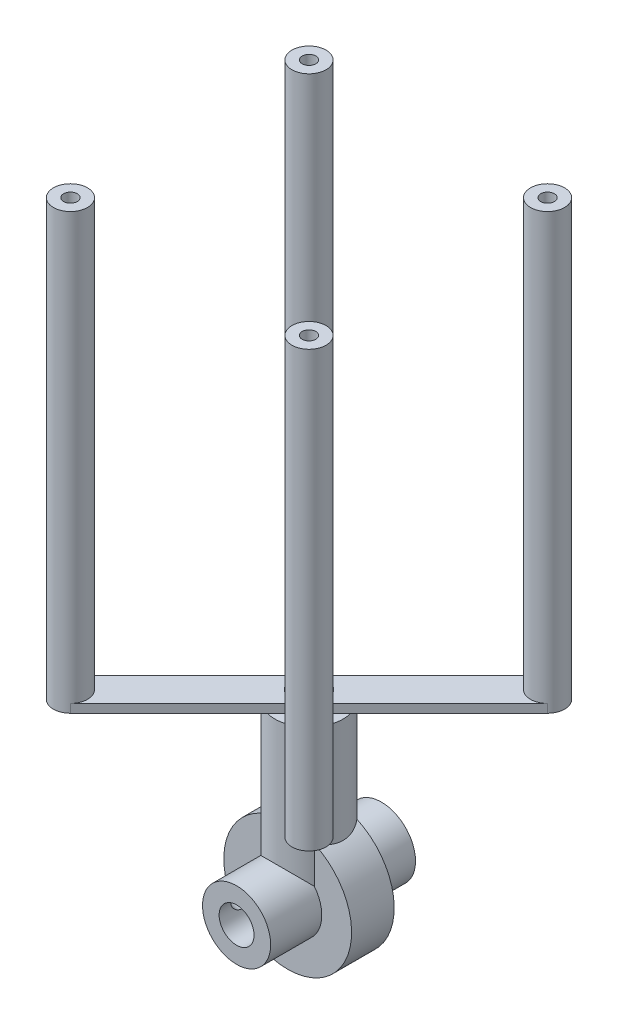
from build123d import *
from build123d.topology import SkipClean

# Parameters (mm, degrees)
SKETCH1_R                           = 7.5000000000000115
SKETCH1_R_2                         = 2.0499999999999923
BOSS_EXTRUDE1_DEPTH                 = 2.5
SKETCH2_R                           = 4.000000000000007
SKETCH2_R_2                         = 2.0499999999999923
BOSS_EXTRUDE2_DEPTH                 = 6
SKETCH7_W                           = 4
SKETCH7_H                           = 18.68716473083859
REVOLVE7_ANGLE                      = 180.0000000000004
SKETCH8_W                           = 2.049999999999997
SKETCH8_H                           = 18.68716473083859
SKETCH9_R                           = 2.0499999999999923
CUT_EXTRUDE1_DEPTH                  = 5
BOSS_EXTRUDE3_START                 = 1
SKETCH10_R                          = 2.049999999999978
BOSS_EXTRUDE3_DEPTH                 = 1
BOSS_EXTRUDE4_START                 = 50
SKETCH11_R                          = 1.9999999999999962
BOSS_EXTRUDE4_DEPTH                 = 50
M3X0_5_TAPPED_HOLE1_REACH           = 76.406
M3X0_5_TAPPED_HOLE1_BORE_R          = 1.25
M3X0_5_TAPPED_HOLE1_ON_FACE_2_REACH = 76.436
M3X0_5_TAPPED_HOLE1_BORE_2_R        = 1.25
M2X0_4_TAPPED_HOLE1_D               = 1.6
M2X0_4_TAPPED_HOLE1_DEPTH           = 18
M2X0_4_TAPPED_HOLE1_TIP             = 0.48068849522204826


with BuildPart() as part:
    # Sketch1 → Boss-Extrude1 (new body)
    with BuildSketch(Plane.XY):
        with Locations((102.34120530056146, 36.41611338878192)):
            Circle(SKETCH1_R)
        with Locations((102.34120530056146, 36.41611338878192)):
            Circle(SKETCH1_R_2, mode=Mode.SUBTRACT)
    boss_extrude1 = extrude(amount=BOSS_EXTRUDE1_DEPTH)

    # Sketch2 → Boss-Extrude2 (add)
    with BuildSketch(Plane.XY.offset(2.5)):
        with Locations((102.34120530056146, 36.41611338878192)):
            Circle(SKETCH2_R)
        with Locations((102.34120530056146, 36.41611338878192)):
            Circle(SKETCH2_R_2, mode=Mode.SUBTRACT)
    boss_extrude2 = extrude(amount=BOSS_EXTRUDE2_DEPTH)

    # Sketch7 → Revolve7 (revolve)
    with BuildSketch(Plane(origin=(0, 0, 0), x_dir=(-1, 0, 0), z_dir=(0, 0, -1))):
        with Locations((-104.34120530056146, 45.75969575420122)):
            Rectangle(SKETCH7_W, SKETCH7_H)
    revolve7 = revolve(axis=Axis((102.34120530056146, 36.41611338878192, 0), (0, -1, 0)), revolution_arc=REVOLVE7_ANGLE)

    # Sketch8 → Cut-Revolve2 (revolve, cut)
    with BuildSketch(Plane(origin=(0, 0, 0), x_dir=(-1, 0, 0), z_dir=(0, 0, -1))):
        with Locations((-103.36620530056146, 45.75969575420122)):
            Rectangle(SKETCH8_W, SKETCH8_H)
    cut_revolve2 = revolve(axis=Axis((102.34120530056146, 36.41611338878192, 0), (0, 1, 0)), mode=Mode.SUBTRACT)

    # Sketch9 → Cut-Extrude1 (cut)
    with BuildSketch(Plane(origin=(0, 0, 0), x_dir=(-1, 0, 0), z_dir=(0, 0, -1))):
        with Locations((-102.34120530056146, 36.41611338878192)):
            Circle(SKETCH9_R)
    cut_extrude1 = extrude(amount=-CUT_EXTRUDE1_DEPTH, mode=Mode.SUBTRACT)

    # Mirror1: Boss-Extrude1, Boss-Extrude2, Revolve7, Cut-Revolve2, Cut-Extrude1 across plane
    with SkipClean():  # the faces are left unmerged after this step: merging them gives an invalid solid
        add(boss_extrude1.mirror(Plane(origin=(102.34120530056146, 36.41611338878192, 0), x_dir=(1, 0, 0), z_dir=(0, 0, 1))))
        add(boss_extrude2.mirror(Plane(origin=(102.34120530056146, 36.41611338878192, 0), x_dir=(1, 0, 0), z_dir=(0, 0, 1))))
        add(revolve7.mirror(Plane(origin=(102.34120530056146, 36.41611338878192, 0), x_dir=(1, 0, 0), z_dir=(0, 0, 1))))
        add(cut_revolve2.mirror(Plane(origin=(102.34120530056146, 36.41611338878192, 0), x_dir=(1, 0, 0), z_dir=(0, 0, 1))), mode=Mode.SUBTRACT)
        add(cut_extrude1.mirror(Plane(origin=(102.34120530056146, 36.41611338878192, 0), x_dir=(1, 0, 0), z_dir=(0, 0, 1))), mode=Mode.SUBTRACT)

    # Sketch10 → Boss-Extrude3 (add)
    with BuildSketch(Plane(origin=(0, 55.103278119620505, 0), x_dir=(1, 0, 0), z_dir=(0, 1, 0)).offset(BOSS_EXTRUDE3_START)):
        with BuildLine():
            Line((102.34120530056146, 2.8284271247461854), (89.75541886293455, 15.4142135623731))
            ThreePointArc((89.75541886293455, 15.4142135623731), (86.92699173818836, 15.414213562373098), (86.92699173818835, 12.585786437626904))
            Line((86.92699173818835, 12.585786437626904), (99.51277817581526, 1.453e-14))
            Line((99.51277817581526, 1.453e-14), (86.92699173818836, -12.585786437626886))
            ThreePointArc((86.92699173818836, -12.585786437626886), (86.92699173818838, -15.414213562373114), (89.75541886293458, -15.41421356237309))
            Line((89.75541886293458, -15.41421356237309), (102.34120530056148, -2.8284271247462023))
            Line((102.34120530056148, -2.8284271247462023), (114.92699173818836, -15.414213562373098))
            ThreePointArc((114.92699173818836, -15.414213562373098), (117.75541886293455, -15.414213562373096), (117.75541886293456, -12.5857864376269))
            Line((117.75541886293456, -12.5857864376269), (105.16963242530763, 1.767e-14))
            Line((105.16963242530763, 1.767e-14), (117.75541886293452, 12.585786437626926))
            ThreePointArc((117.75541886293452, 12.585786437626926), (117.75541886293452, 15.414213562373076), (114.92699173818835, 15.414213562373087))
            Line((114.92699173818835, 15.414213562373087), (102.34120530056146, 2.8284271247461854))
        make_face()
        with Locations((102.34120530056148, 0)):
            Circle(SKETCH10_R, mode=Mode.SUBTRACT)
    extrude(amount=-BOSS_EXTRUDE3_DEPTH)

    # Sketch11 → Boss-Extrude4 (add)
    with BuildSketch(Plane(origin=(0, 56.103278119620505, 0), x_dir=(1, 0, 0), z_dir=(0, 1, 0)).offset(BOSS_EXTRUDE4_START)):
        with Locations((88.34120530056146, 14.000000000000002)):
            Circle(SKETCH11_R)
        with Locations((116.34120530056154, 14.000000000000359)):
            Circle(SKETCH11_R)
        with Locations((116.3412053005618, -13.999999999999707)):
            Circle(SKETCH11_R)
        with Locations((88.34120530056171, -13.99999999999986)):
            Circle(SKETCH11_R)
    extrude(amount=-BOSS_EXTRUDE4_DEPTH)

    # M3x0.5 Tapped Hole1 bore (on position points) → M3x0.5 Tapped Hole1 (cut, up to next)
    with BuildSketch(Plane(origin=(98.587954415, 37.799264786, 5.923678009), x_dir=(-0.345787849288, -0.938312721477, 0), z_dir=(-0.938312721477, 0.345787849288, 0)), mode=Mode.PRIVATE) as m3x0_5_tapped_hole1_sk1:
        Circle(M3X0_5_TAPPED_HOLE1_BORE_R)
    m3x0_5_tapped_hole1_tool1 = extrude(m3x0_5_tapped_hole1_sk1.sketch, amount=-M3X0_5_TAPPED_HOLE1_REACH, mode=Mode.PRIVATE) & part.part
    add(m3x0_5_tapped_hole1_tool1.solids().sort_by_distance((98.587954, 37.799265, 5.923678))[0], mode=Mode.SUBTRACT)

    # M3x0.5 Tapped Hole1 bore 2 (on position points) → M3x0.5 Tapped Hole1 on face 2 (cut, up to next)
    with BuildSketch(Plane(origin=(98.537036141, 37.652356489, -5.51866452), x_dir=(-0.309061063746, -0.95104219616, 0), z_dir=(-0.95104219616, 0.309061063746, 0)), mode=Mode.PRIVATE) as m3x0_5_tapped_hole1_on_face_2_sk1:
        Circle(M3X0_5_TAPPED_HOLE1_BORE_2_R)
    m3x0_5_tapped_hole1_on_face_2_tool1 = extrude(m3x0_5_tapped_hole1_on_face_2_sk1.sketch, amount=-M3X0_5_TAPPED_HOLE1_ON_FACE_2_REACH, mode=Mode.PRIVATE) & part.part
    add(m3x0_5_tapped_hole1_on_face_2_tool1.solids().sort_by_distance((98.537036, 37.652356, -5.518665))[0], mode=Mode.SUBTRACT)

    # M2x0.4 Tapped Hole1
    with Locations(Plane(origin=(88.341205301, 106.10327812, -14), x_dir=(0, 0, 1), z_dir=(0, 1, 0))):
        with Locations((0, 0), (28, 0), (28, 28), (0, 28)):
            Hole(M2X0_4_TAPPED_HOLE1_D / 2, depth=M2X0_4_TAPPED_HOLE1_DEPTH)
            with Locations((0, 0, -(M2X0_4_TAPPED_HOLE1_DEPTH + M2X0_4_TAPPED_HOLE1_TIP / 2))):  # 118° drill point
                Cone(0, M2X0_4_TAPPED_HOLE1_D / 2, M2X0_4_TAPPED_HOLE1_TIP, mode=Mode.SUBTRACT)


solid = part.part
